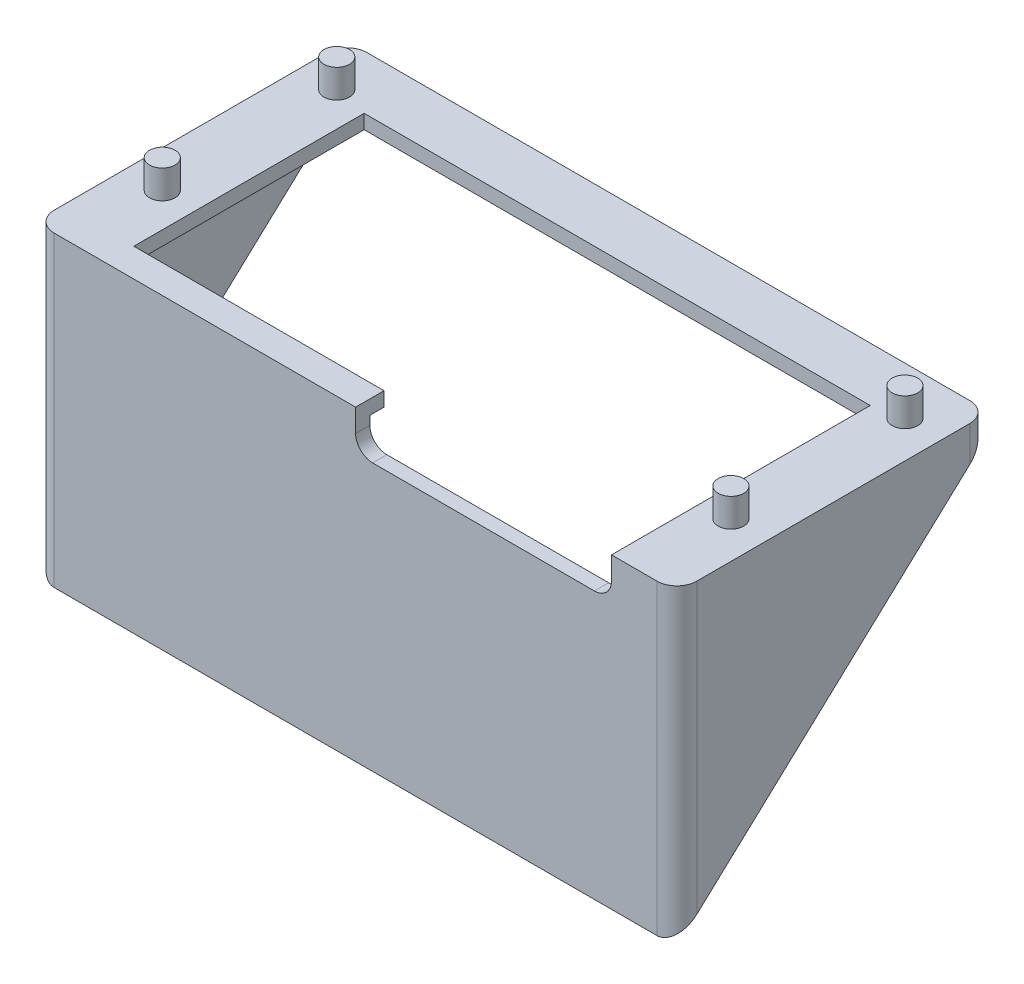
from build123d import *

# Parameters (mm, degrees)
SKETCH1_W           = 113
SKETCH1_H           = 55
BOSS_EXTRUDE1_DEPTH = 3
BOSS_EXTRUDE3_DEPTH = 113
SKETCH2_R           = 2.25
BOSS_EXTRUDE2_DEPTH = 5
SHELL1_START        = -50.038745387
SHELL1_DEPTH        = 108
SKETCH4_W           = 88
SKETCH4_H           = 40.5
CUT_EXTRUDE1_DEPTH  = 10
FILLET2_R           = 3.5
CUT_EXTRUDE2_REACH  = 98.336
SKETCH5_W           = 45
SKETCH5_H           = 7
FILLET3_R           = 3


# Read off the part's stored shape, not the designer's step: Shell1
with BuildPart() as part:
    # Sketch1 → Boss-Extrude1 (new body)
    with BuildSketch(Plane(origin=(0, 0, 0), x_dir=(1, 0, 0), z_dir=(0, 1, 0))):
        with Locations((3.961254613, 12.529520295)):
            Rectangle(SKETCH1_W, SKETCH1_H)
    extrude(amount=BOSS_EXTRUDE1_DEPTH)

    # Sketch3 → Boss-Extrude3 (add)
    with BuildSketch(Plane(origin=(60.461254613, 0, 0), x_dir=(0, 0, -1), z_dir=(1, 0, 0))):
        Polygon((-14.970479705, 0), (-14.970479705, -50.990195136), (40.029520295, 0), align=None)
    extrude(amount=-BOSS_EXTRUDE3_DEPTH)

    # Sketch2 → Boss-Extrude2 (add)
    with BuildSketch(Plane(origin=(0, 3, 0), x_dir=(1, 0, 0), z_dir=(0, 1, 0))):
        with Locations(Location((-46.038745387, 31.709520295, 0), (0, 0, 270))):
            Circle(SKETCH2_R)
        with Locations(Location((53.961254613, 31.629520295, 0), (0, 0, 270))):
            Circle(SKETCH2_R)
        with Locations(Location((53.961254613, 1.029520295, 0), (0, 0, 270))):
            Circle(SKETCH2_R)
        with Locations(Location((-46.038745387, 1.029520295, 0), (0, 0, 270))):
            Circle(SKETCH2_R)
    extrude(amount=BOSS_EXTRUDE2_DEPTH)

    # Shell1 outline → Shell1 (cut)
    with BuildSketch(Plane.YZ.offset(SHELL1_START)):
        Polygon((0.5, 12.470479705), (-48.672458993, 12.470479705), (-2.317736143, -37.529520295), (0.5, -37.529520295), align=None)
    extrude(amount=SHELL1_DEPTH, mode=Mode.SUBTRACT)

    # Sketch4 → Cut-Extrude1 (cut)
    with BuildSketch(Plane.XZ.offset(-0.5)):
        with Locations((3.961254613, -10.279520295)):
            Rectangle(SKETCH4_W, SKETCH4_H)
    extrude(amount=-CUT_EXTRUDE1_DEPTH, mode=Mode.SUBTRACT)

    # Fillet2
    fillet2_edges = [part.edges().sort_by_distance(p)[0] for p in [
        (-52.538745387, 1.5, -40.029520295),
        (60.461254613, 1.5, -40.029520295),
        (60.461254613, -23.995097568, 14.970479705),
        (-52.538745387, -23.995097568, 14.970479705),
    ]]
    fillet(fillet2_edges, radius=FILLET2_R)

    # Cut-Extrude2: up to this face of the body (flat: up to its plane)
    cut_extrude2_end = Plane(part.part.faces().sort_by_distance((3.961254613, 1.75, -30.529520295))[0])
    # Sketch5 → Cut-Extrude2 (cut, up to the picked face)
    with BuildSketch(Plane.XY.offset(14.970479705), mode=Mode.PRIVATE) as cut_extrude2_sk1:
        with Locations((26.461254613, -0.5)):
            Rectangle(SKETCH5_W, SKETCH5_H)
    cut_extrude2_tool1 = split(extrude(cut_extrude2_sk1.sketch, amount=-CUT_EXTRUDE2_REACH, mode=Mode.PRIVATE), bisect_by=cut_extrude2_end, keep=Keep.BOTH, mode=Mode.PRIVATE)
    add(cut_extrude2_tool1.solids().sort_by(Axis((26.461255, -0.5, 14.97048), (0, 0, -1)))[0], mode=Mode.SUBTRACT)

    # Fillet3
    fillet3_edges = [part.edges().sort_by_distance(p)[0] for p in [
        (48.961254613, -4, 13.720479705),
        (3.961254613, -4, 13.720479705),
    ]]
    fillet(fillet3_edges, radius=FILLET3_R)


solid = part.part
